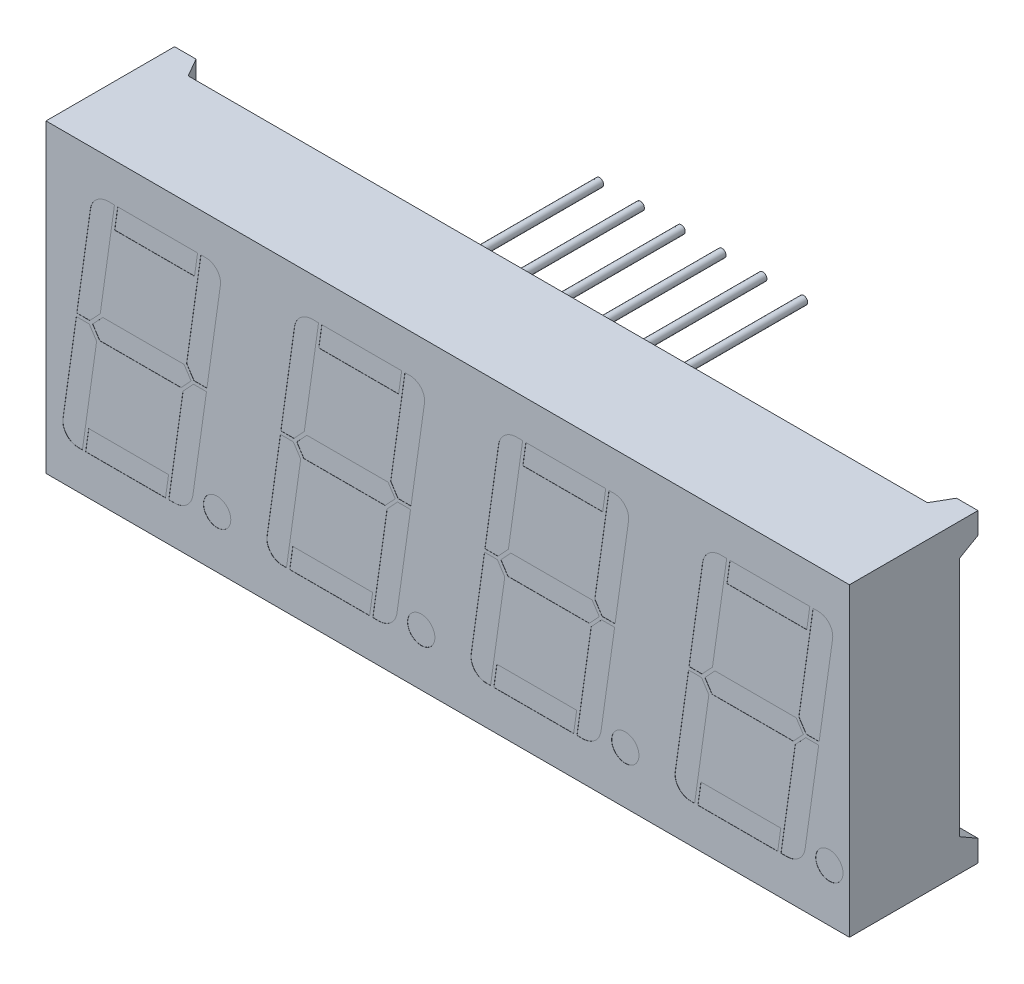
from build123d import *

# Parameters (mm, degrees)
SKETCH1_W           = 25
SKETCH1_H           = 19
BOSS_EXTRUDE1_DEPTH = 8
CUT_EXTRUDE9_REACH  = 29.915
CUT_EXTRUDE3_REACH  = 26.109
SKETCH7_R           = 0.25
BOSS_EXTRUDE2_DEPTH = 8.95
SKETCH9_R           = 0.85
CUT_EXTRUDE10_DEPTH = 0.01
MIRROR1_START       = 1.15
MIRROR1_OUTLINE_W   = 25
MIRROR1_OUTLINE_H   = 19
MIRROR1_DEPTH       = 6.85
MIRROR1_START_2     = -7.8
MIRROR1_2_OUTLINE_R = 0.25
MIRROR1_2_DEPTH     = 8.95
MIRROR1_START_3     = -37.5
MIRROR1_3_DEPTH     = 2
MIRROR1_START_4     = -31.318901834
MIRROR1_4_DEPTH     = 1.318901834
LPATTERN1_COUNT     = 4
LPATTERN1_PITCH     = 12.7


with BuildPart() as part:
    # Sketch1 → Boss-Extrude1 (new body)
    with BuildSketch(Plane.XY):
        Rectangle(SKETCH1_W, SKETCH1_H)
    extrude(amount=BOSS_EXTRUDE1_DEPTH)

    # Sketch8 → Cut-Extrude9 (cut, up to next)
    with BuildSketch(Plane(origin=(12.5, 0, 0), x_dir=(0, 0, -1), z_dir=(1, 0, 0)), mode=Mode.PRIVATE) as cut_extrude9_sk1:
        Polygon((-1.15, 7.5), (-1.15, -7.5), (0, -8.16395281), (0, 8.16395281), align=None)
    cut_extrude9_tool1 = extrude(cut_extrude9_sk1.sketch, amount=-CUT_EXTRUDE9_REACH, mode=Mode.PRIVATE) & part.part
    add(cut_extrude9_tool1.solids().sort_by_distance((12.5, 0, 0.566876))[0], mode=Mode.SUBTRACT)

    # Cut-Extrude3: up to this face of the body (flat: up to its plane)
    cut_extrude3_end = Plane(part.part.faces().sort_by_distance((0, 9.5, 4))[0])
    # Sketch6 → Cut-Extrude3 (cut, up to the picked face)
    with BuildSketch(Plane.XZ.offset(9.5), mode=Mode.PRIVATE) as cut_extrude3_sk1:
        Polygon((11.16395281, 0), (10.5, 1.15), (-12.5, 1.15), (-12.5, 0), align=None)
    cut_extrude3_tool1 = split(extrude(cut_extrude3_sk1.sketch, amount=-CUT_EXTRUDE3_REACH, mode=Mode.PRIVATE), bisect_by=cut_extrude3_end, keep=Keep.BOTH, mode=Mode.PRIVATE)
    add(cut_extrude3_tool1.solids().sort_by(Axis((-0.833225, -9.5, 0.572273), (0, 1, 0)))[0], mode=Mode.SUBTRACT)

    # Sketch7 → Boss-Extrude2 (add)
    with BuildSketch(Plane(origin=(0, 0, 1.15), x_dir=(-1, 0, 0), z_dir=(0, 0, -1))):
        with Locations(Location((8.69, 7.62, 0), (0, 0, 180))):
            Circle(SKETCH7_R)
        with Locations(Location((6.15, 7.62, 0), (0, 0, 180))):
            Circle(SKETCH7_R)
        with Locations(Location((11.23, 7.62, 0), (0, 0, 180))):
            Circle(SKETCH7_R)
        with Locations(Location((8.69, -7.65, 0), (0, 0, 180))):
            Circle(SKETCH7_R)
        with Locations(Location((6.15, -7.65, 0), (0, 0, 180))):
            Circle(SKETCH7_R)
        with Locations(Location((11.23, -7.65, 0), (0, 0, 180))):
            Circle(SKETCH7_R)
    extrude(amount=BOSS_EXTRUDE2_DEPTH)

    # Sketch9 → Cut-Extrude10 (cut)
    with BuildSketch(Plane.XY.offset(8)):
        with Locations((11.25, -6.25)):
            Circle(SKETCH9_R)
        with Locations((-1.45, -6.25)):
            Circle(SKETCH9_R)
        with BuildLine():
            Line((2.514054083, 0.1), (3.361066864, 6.126809093))
            ThreePointArc((3.361066864, 6.126809093), (3.738900316, 6.822691744), (4.480594938, 7.1))
            Line((4.480594938, 7.1), (4.861107149, 7.1))
            Line((4.861107149, 7.1), (3.975699891, 0.8))
            Line((3.975699891, 0.8), (3.321916141, 0.1))
            Line((3.321916141, 0.1), (2.514054083, 0.1))
        make_face()
        with BuildLine():
            Line((10.614054083, 0.1), (9.806192025, 0.1))
            Line((9.806192025, 0.1), (9.349165445, 0.8))
            Line((9.349165445, 0.8), (10.234572703, 7.1))
            Line((10.234572703, 7.1), (10.55810011, 7.1))
            ThreePointArc((10.55810011, 7.1), (11.240230804, 6.789135133), (11.453136112, 6.07037886))
            Line((11.453136112, 6.07037886), (10.614054083, 0.1))
        make_face()
        with BuildLine():
            Line((2.485945917, -0.1), (3.293807975, -0.1))
            Line((3.293807975, -0.1), (3.750834555, -0.8))
            Line((3.750834555, -0.8), (2.865427297, -7.1))
            Line((2.865427297, -7.1), (2.599611182, -7.1))
            ThreePointArc((2.599611182, -7.1), (1.879618474, -6.771880419), (1.654895748, -6.01322921))
            Line((1.654895748, -6.01322921), (2.485945917, -0.1))
        make_face()
        with BuildLine():
            Line((10.585945917, -0.1), (9.74193359, -6.105459754))
            ThreePointArc((9.74193359, -6.105459754), (9.355811431, -6.816608304), (8.597845911, -7.1))
            Line((8.597845911, -7.1), (8.238892851, -7.1))
            Line((8.238892851, -7.1), (9.124300109, -0.8))
            Line((9.124300109, -0.8), (9.778083859, -0.1))
            Line((9.778083859, -0.1), (10.585945917, -0.1))
        make_face()
        Polygon((3.257122938, -5.75), (8.226657463, -5.75), (8.036927336, -7.1), (3.067392811, -7.1), align=None)
        Polygon((5.063072664, 7.1), (10.032607189, 7.1), (9.842877062, 5.75), (4.873342537, 5.75), align=None)
        Polygon((4.132617744, 0.675), (9.191924071, 0.675), (9.632628274, 0), (9.002193944, -0.675), (3.942887617, -0.675), (3.502183414, 0), align=None)
        Polygon((-9.442877062, -5.75), (-4.473342537, -5.75), (-4.663072664, -7.1), (-9.632607189, -7.1), align=None)
        with BuildLine():
            Line((-9.834572703, -7.1), (-10.100388818, -7.1))
            ThreePointArc((-10.100388818, -7.1), (-10.820381526, -6.771880419), (-11.045104252, -6.01322921))
            Line((-11.045104252, -6.01322921), (-10.214054083, -0.1))
            Line((-10.214054083, -0.1), (-9.406192025, -0.1))
            Line((-9.406192025, -0.1), (-8.949165445, -0.8))
            Line((-8.949165445, -0.8), (-9.834572703, -7.1))
        make_face()
        with BuildLine():
            Line((-9.378083859, 0.1), (-10.185945917, 0.1))
            Line((-10.185945917, 0.1), (-9.338933136, 6.126809093))
            ThreePointArc((-9.338933136, 6.126809093), (-8.961099684, 6.822691744), (-8.219405062, 7.1))
            Line((-8.219405062, 7.1), (-7.838892851, 7.1))
            Line((-7.838892851, 7.1), (-8.724300109, 0.8))
            Line((-8.724300109, 0.8), (-9.378083859, 0.1))
        make_face()
        Polygon((-9.197816586, 0), (-8.567382256, 0.675), (-3.508075929, 0.675), (-3.067371726, 0), (-3.697806056, -0.675), (-8.757112383, -0.675), align=None)
        Polygon((-7.636927336, 7.1), (-2.667392811, 7.1), (-2.857122938, 5.75), (-7.826657463, 5.75), align=None)
        with BuildLine():
            Line((-2.465427297, 7.1), (-2.14189989, 7.1))
            ThreePointArc((-2.14189989, 7.1), (-1.459769196, 6.789135133), (-1.246863888, 6.07037886))
            Line((-1.246863888, 6.07037886), (-2.085945917, 0.1))
            Line((-2.085945917, 0.1), (-2.893807975, 0.1))
            Line((-2.893807975, 0.1), (-3.350834555, 0.8))
            Line((-3.350834555, 0.8), (-2.465427297, 7.1))
        make_face()
        with BuildLine():
            Line((-4.102154089, -7.1), (-4.461107149, -7.1))
            Line((-4.461107149, -7.1), (-3.575699891, -0.8))
            Line((-3.575699891, -0.8), (-2.921916141, -0.1))
            Line((-2.921916141, -0.1), (-2.114054083, -0.1))
            Line((-2.114054083, -0.1), (-2.95806641, -6.105459754))
            ThreePointArc((-2.95806641, -6.105459754), (-3.344188569, -6.816608304), (-4.102154089, -7.1))
        make_face()
    cut_extrude10 = extrude(amount=-CUT_EXTRUDE10_DEPTH, mode=Mode.SUBTRACT)

    # Mirror1: read off the stored shape, not the designer's step
    # Mirror1 outline → Mirror1 (add)
    with BuildSketch(Plane.XY.offset(MIRROR1_START)):
        with Locations((-25, 0)):
            Rectangle(MIRROR1_OUTLINE_W, MIRROR1_OUTLINE_H)
    extrude(amount=MIRROR1_DEPTH)

    # Mirror1 2 outline → Mirror1 2 (add)
    with BuildSketch(Plane.XY.offset(MIRROR1_START_2)):
        with Locations((-16.31, 7.62)):
            Circle(MIRROR1_2_OUTLINE_R)
        with Locations((-13.77, 7.62)):
            Circle(MIRROR1_2_OUTLINE_R)
        with Locations((-18.85, 7.62)):
            Circle(MIRROR1_2_OUTLINE_R)
        with Locations((-16.31, -7.65)):
            Circle(MIRROR1_2_OUTLINE_R)
        with Locations((-18.85, -7.65)):
            Circle(MIRROR1_2_OUTLINE_R)
        with Locations((-13.77, -7.65)):
            Circle(MIRROR1_2_OUTLINE_R)
    extrude(amount=MIRROR1_2_DEPTH)

    # Mirror1 3 outline → Mirror1 3 (add)
    with BuildSketch(Plane.YZ.offset(MIRROR1_START_3)):
        Polygon((-8.16395281, 0), (-7.5, 1.15), (-9.5, 1.15), (-9.5, 0), align=None)
        Polygon((8.16395281, 0), (9.5, 0), (9.5, 1.15), (7.5, 1.15), align=None)
    extrude(amount=MIRROR1_3_DEPTH)

    # Mirror1 4 outline → Mirror1 4 (cut)
    with BuildSketch(Plane(origin=(0, 0, 0), x_dir=(0.49999999999999767, 0, 0.86602540378444), z_dir=(0.8660254037844399, 0, -0.49999999999999795)).offset(MIRROR1_START_4)):
        Polygon((-18.081976405, 8.16395281), (-16.754070786, 7.5), (-16.754070786, 9.5), (-18.081976405, 9.5), align=None)
        Polygon((-16.754070786, -7.5), (-18.081976405, -8.16395281), (-18.081976405, -9.5), (-16.754070786, -9.5), align=None)
    extrude(amount=MIRROR1_4_DEPTH, mode=Mode.SUBTRACT)

    # LPattern1: Cut-Extrude10 ×4
    with Locations(*[(-i * LPATTERN1_PITCH, 0, 0) for i in range(1, LPATTERN1_COUNT)]):
        add(cut_extrude10, mode=Mode.SUBTRACT)


solid = part.part
